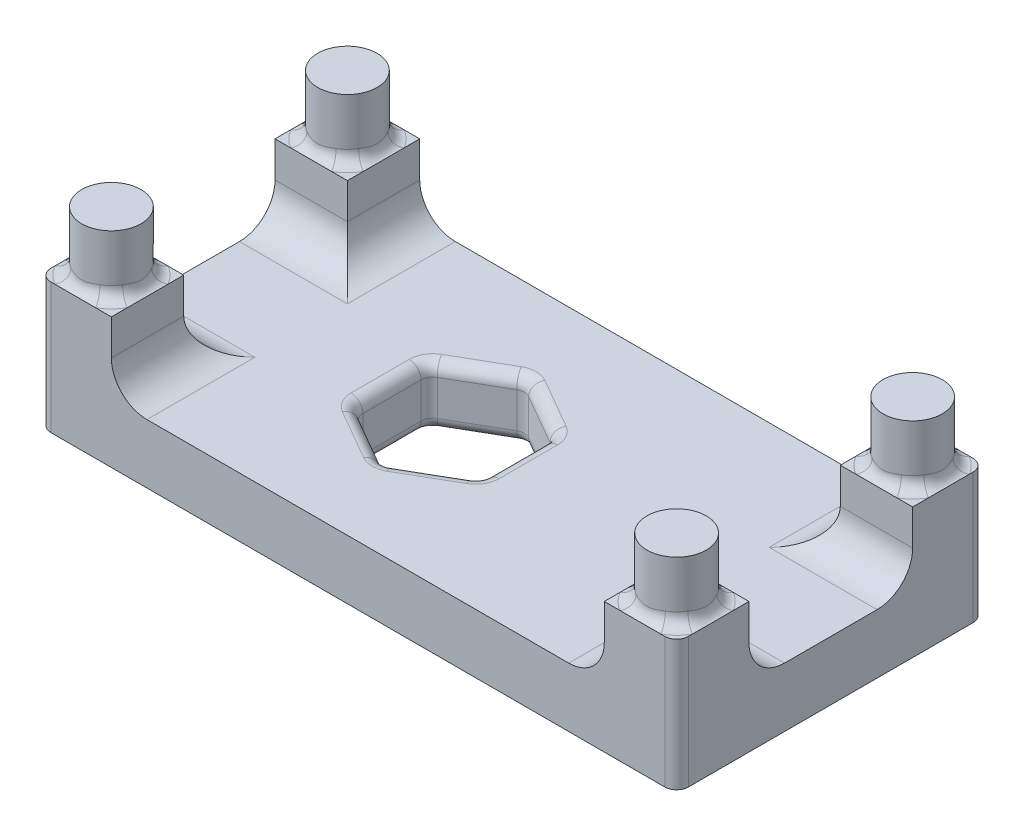
from build123d import *

# Parameters (mm, degrees)
SKETCH2_W           = 53.76
SKETCH2_H           = 26
BOSS_EXTRUDE1_DEPTH = 5
SKETCH2_3_W         = 6.1
SKETCH2_3_H         = 6.1
BOSS_EXTRUDE2_DEPTH = 11
SKETCH2_4_R         = 2.5
BOSS_EXTRUDE3_DEPTH = 16
FILLET1_R           = 1
FILLET2_R           = 1
FILLET3_R           = 1
FILLET4_R           = 3


with BuildPart() as part:
    # Sketch2 → Boss-Extrude1 (new body)
    with BuildSketch(Plane(origin=(0, 0, 0), x_dir=(1, 0, 0), z_dir=(0, 1, 0))):
        Rectangle(SKETCH2_W, SKETCH2_H)
        Polygon((0.38, -3.031088913), (-4.87, -6.062177826), (-10.12, -3.031088913), (-10.12, 3.031088913), (-4.87, 6.062177826), (0.38, 3.031088913), align=None, mode=Mode.SUBTRACT)
    extrude(amount=BOSS_EXTRUDE1_DEPTH)

    # Sketch2<3> → Boss-Extrude2 (add)
    with BuildSketch(Plane(origin=(0, 0, 0), x_dir=(1, 0, 0), z_dir=(0, 1, 0))):
        with Locations((-23.83, 9.95)):
            Rectangle(SKETCH2_3_W, SKETCH2_3_H)
        with Locations((23.83, 9.95)):
            Rectangle(SKETCH2_3_W, SKETCH2_3_H)
        with Locations((23.83, -9.95)):
            Rectangle(SKETCH2_3_W, SKETCH2_3_H)
        with Locations((-23.83, -9.95)):
            Rectangle(SKETCH2_3_W, SKETCH2_3_H)
    extrude(amount=BOSS_EXTRUDE2_DEPTH)

    # Sketch2<4> → Boss-Extrude3 (add)
    with BuildSketch(Plane(origin=(0, 0, 0), x_dir=(1, 0, 0), z_dir=(0, 1, 0))):
        with Locations(Location((-23.83, -9.95, 0), (0, 0, 270))):
            Circle(SKETCH2_4_R)
        with Locations(Location((-23.83, 9.95, 0), (0, 0, 270))):
            Circle(SKETCH2_4_R)
        with Locations(Location((23.83, 9.95, 0), (0, 0, 90))):
            Circle(SKETCH2_4_R)
        with Locations(Location((23.83, -9.95, 0), (0, 0, 90))):
            Circle(SKETCH2_4_R)
    extrude(amount=BOSS_EXTRUDE3_DEPTH)

    # Fillet1
    fillet1_edges = [part.edges().sort_by_distance(p)[0] for p in [
        (23.83, 11, 12.45),
        (23.83, 11, -7.45),
        (-23.83, 11, -12.45),
        (-23.83, 11, 7.45),
    ]]
    fillet(fillet1_edges, radius=FILLET1_R)

    # Fillet2
    fillet2_edges = [part.edges().sort_by_distance(p)[0] for p in [
        (-4.87, 2.5, -6.062177826),
        (-10.12, 2.5, -3.031088913),
        (-10.12, 2.5, 3.031088913),
        (-4.87, 2.5, 6.062177826),
        (0.38, 2.5, 3.031088913),
        (0.38, 2.5, -3.031088913),
        (26.88, 5.5, 13),
        (-26.88, 5.5, 13),
        (-26.88, 5.5, -13),
        (26.88, 5.5, -13),
    ]]
    fillet(fillet2_edges, radius=FILLET2_R)

    # Fillet3
    fillet3_edges = [part.edges().sort_by_distance(p)[0] for p in [
        (0.38, 0, 0),
        (0.38, 5, 0),
        (-2.245, 0, -4.54663337),
        (-2.245, 5, -4.54663337),
        (-2.245, 0, 4.54663337),
        (-2.245, 5, 4.54663337),
        (-7.495, 0, -4.54663337),
        (-10.12, 0, 0),
        (-7.495, 0, 4.54663337),
        (-7.495, 5, -4.54663337),
        (-10.12, 5, 0),
        (-7.495, 5, 4.54663337),
        (0.246025404, 0, -2.953738644),
        (0.246025404, 5, -2.953738644),
        (0.246025404, 0, 2.953738644),
        (0.246025404, 5, 2.953738644),
        (-4.87, 0, -5.907477288),
        (-4.87, 5, -5.907477288),
        (-9.986025404, 0, -2.953738644),
        (-9.986025404, 5, -2.953738644),
        (-9.986025404, 0, 2.953738644),
        (-9.986025404, 5, 2.953738644),
        (-4.87, 0, 5.907477288),
        (-4.87, 5, 5.907477288),
    ]]
    fillet(fillet3_edges, radius=FILLET3_R)

    # Fillet4
    fillet4_edges = [part.edges().sort_by_distance(p)[0] for p in [
        (-23.83, 5, 6.9),
        (-20.78, 5, 9.95),
        (20.78, 5, 9.95),
        (23.83, 5, 6.9),
        (23.83, 5, -6.9),
        (20.78, 5, -9.95),
        (-23.83, 5, -6.9),
        (-20.78, 5, -9.95),
    ]]
    fillet(fillet4_edges, radius=FILLET4_R)


solid = part.part
